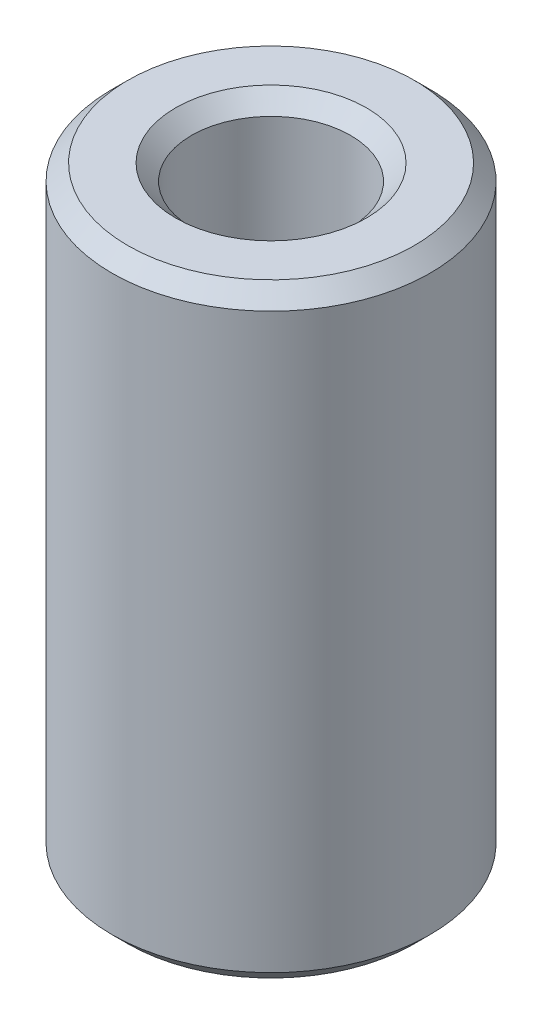
from build123d import *

# Parameters (mm, degrees)
SKETCH1_R           = 5
SKETCH1_R_2         = 2.5
BOSS_EXTRUDE1_DEPTH = 9.5
CHAMFER1_SIZE       = 0.5


with BuildPart() as part:
    # Sketch1 → Boss-Extrude1 (new, symmetric)
    with BuildSketch(Plane(origin=(0, 0, 0), x_dir=(1, 0, 0), z_dir=(0, 1, 0))):
        Circle(SKETCH1_R)
        Circle(SKETCH1_R_2, mode=Mode.SUBTRACT)
    extrude(amount=BOSS_EXTRUDE1_DEPTH, both=True)

    # Chamfer1
    chamfer1_edges = [part.edges().sort_by_distance(p)[0] for p in [
        (-2.5, -9.5, 0),
        (-5, -9.5, 0),
        (-2.5, 9.5, 0),
        (-5, 9.5, 0),
    ]]
    chamfer(chamfer1_edges, length=CHAMFER1_SIZE)


solid = part.part
